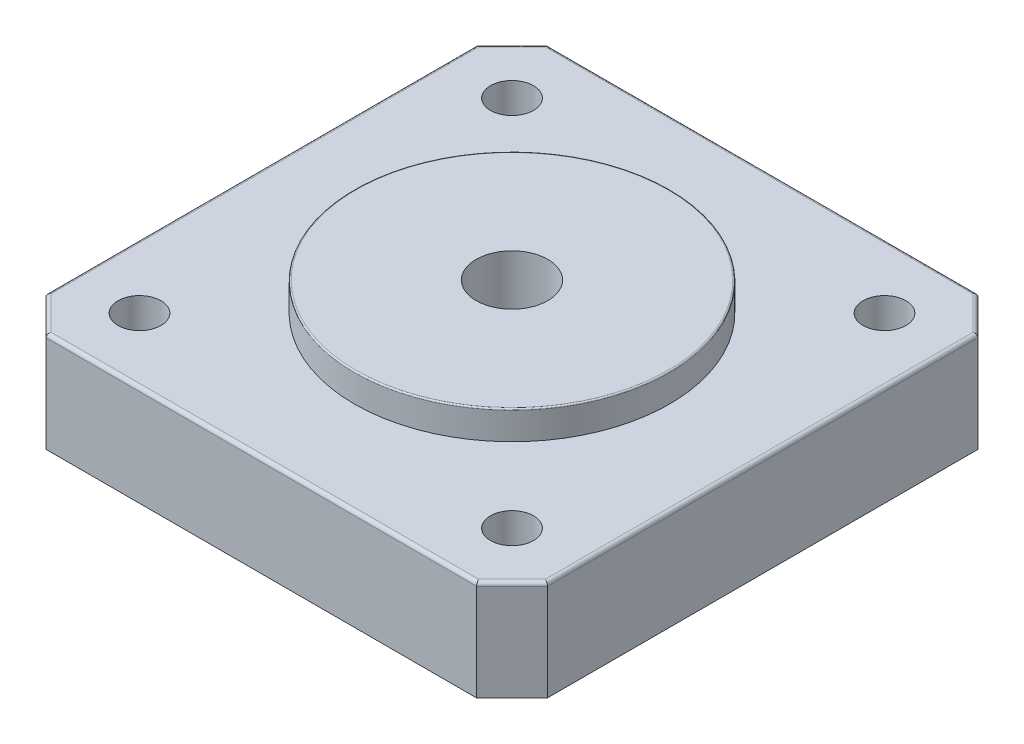
from build123d import *

# Parameters (mm, degrees)
SALIENTE_EXTRUIR1_DEPTH = 7
CROQUIS2_R              = 2.5
CORTAR_EXTRUIR1_DEPTH   = 50.989999
CROQUIS3_R              = 1.5
CORTAR_EXTRUIR2_DEPTH   = 50.989999
SALIENTE_EXTRUIR2_START = 2
CROQUIS4_R              = 11
CROQUIS4_R_2            = 2.5
SALIENTE_EXTRUIR2_DEPTH = 2
REDONDEO1_R             = 0.1
REDONDEO3_R             = 0.25


with BuildPart() as part:
    # Croquis1 → Saliente-Extruir1 (new body)
    with BuildSketch(Plane(origin=(0, 0, 0), x_dir=(1, 0, 0), z_dir=(0, 1, 0))):
        Polygon((0, 32.526911935), (2.473088065, 35), (32.526911935, 35), (35, 32.526911935), (35, 2.473088065), (32.526911935, 0), (2.473088065, 0), (0, 2.473088065), align=None)
    extrude(amount=SALIENTE_EXTRUIR1_DEPTH)

    # Croquis2 → Cortar-Extruir1 (cut, through all)
    with BuildSketch(Plane(origin=(0, 7, 0), x_dir=(1, 0, 0), z_dir=(0, 1, 0))):
        with Locations((17.5, 17.5)):
            Circle(CROQUIS2_R)
    extrude(amount=-CORTAR_EXTRUIR1_DEPTH, mode=Mode.SUBTRACT)

    # Croquis3 → Cortar-Extruir2 (cut, through all)
    with BuildSketch(Plane(origin=(0, 7, 0), x_dir=(1, 0, 0), z_dir=(0, 1, 0))):
        with Locations((4.5, 30.5)):
            Circle(CROQUIS3_R)
        with Locations((30.5, 30.5)):
            Circle(CROQUIS3_R)
        with Locations((30.5, 4.5)):
            Circle(CROQUIS3_R)
        with Locations((4.5, 4.5)):
            Circle(CROQUIS3_R)
    extrude(amount=-CORTAR_EXTRUIR2_DEPTH, mode=Mode.SUBTRACT)

    # Croquis4 → Saliente-Extruir2 (add)
    with BuildSketch(Plane(origin=(0, 7, 0), x_dir=(1, 0, 0), z_dir=(0, 1, 0)).offset(SALIENTE_EXTRUIR2_START)):
        with Locations((17.5, 17.5)):
            Circle(CROQUIS4_R)
        with Locations((17.5, 17.5)):
            Circle(CROQUIS4_R_2, mode=Mode.SUBTRACT)
    extrude(amount=-SALIENTE_EXTRUIR2_DEPTH)

    # Redondeo1
    redondeo1_edges = [part.edges().sort_by_distance(p)[0] for p in [
        (6.5, 9, -17.5),
    ]]
    fillet(redondeo1_edges, radius=REDONDEO1_R)

    # Redondeo3
    redondeo3_edges = [part.edges().sort_by_distance(p)[0] for p in [
        (1.236544033, 7, -33.763455967),
        (17.5, 7, -35),
        (33.763455967, 7, -33.763455967),
        (35, 7, -17.5),
        (33.763455967, 7, -1.236544033),
        (17.5, 7, 0),
        (1.236544033, 7, -1.236544033),
        (0, 7, -17.5),
    ]]
    fillet(redondeo3_edges, radius=REDONDEO3_R)


solid = part.part
